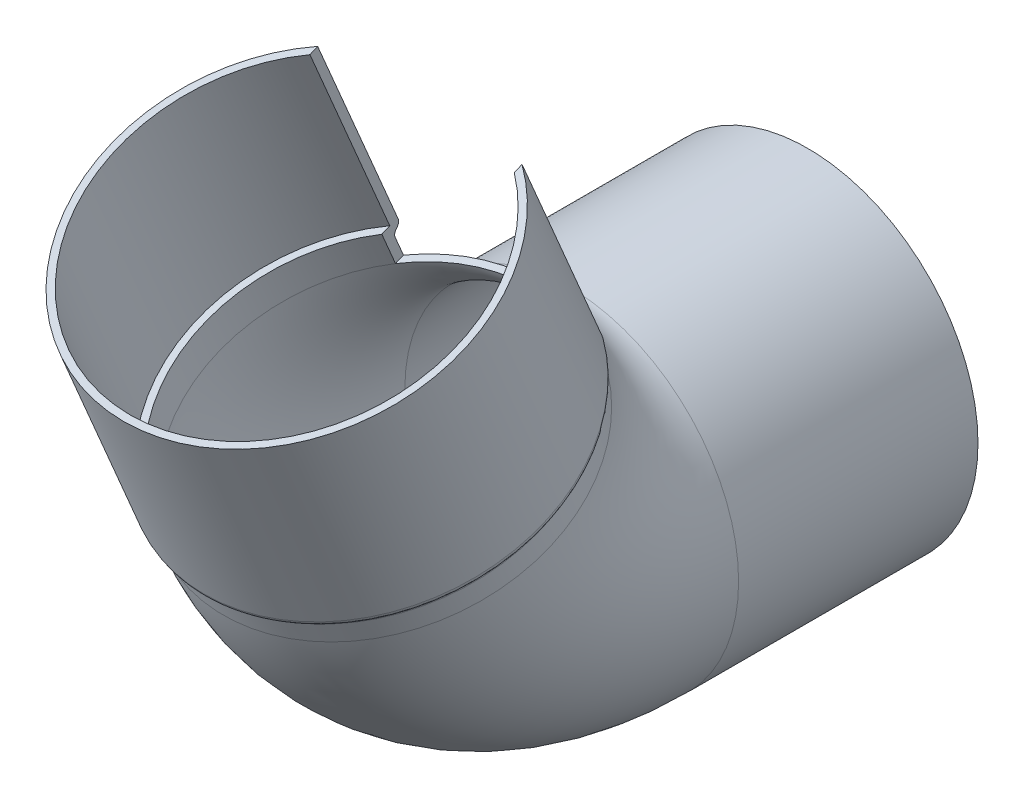
from build123d import *
from build123d.topology import SkipClean

# Parameters (mm, degrees)
ESQUISSE6_R             = 25
ESQUISSE6_R_2           = 24
ESQUISSE8_R             = 26
ESQUISSE8_R_2           = 24
EXTRU_MINCE1_DEPTH      = 1
EXTRU_MINCE2_START      = 30
ESQUISSE9_R             = 26
ESQUISSE9_R_2           = 25
EXTRU_MINCE2_DEPTH      = 30
CONG_1_R                = 1
CONG_2_R                = 1
ENL_V_MAT_EXTRU_1_DEPTH = 40


with BuildPart() as part:
    # Balayage-Mince2: sweep along a path in Esquisse7
    with BuildLine(Plane(origin=(0, 0, 0), x_dir=(0, 0, -1), z_dir=(1, 0, 0))) as balayage_mince2_path:
        Line((0, 0), (-35.14343316412919, -3.47e-15))
        ThreePointArc((-35.14343316412919, -3.47e-15), (-51.70154272349097, 4.983425337984965), (-62.75857876770245, 18.27806614532184))
        Line((-62.75857876770245, 18.27806614532184), (-64.37754708374251, 22.092116482858586))
    # Esquisse6 → Balayage-Mince2 (sweep)
    with BuildSketch(Plane.XY):
        Circle(ESQUISSE6_R)
        Circle(ESQUISSE6_R_2, mode=Mode.SUBTRACT)
    sweep(path=balayage_mince2_path.line)



with BuildPart() as body_2:
    # Esquisse8 → Extru.-Mince1 (new body)
    with BuildSketch(Plane(origin=(0, 41.87396099217143, 17.77444189612002), x_dir=(1, 0, 0), z_dir=(0, 0.9205048534524412, 0.39073112848927183))):
        with Locations((0, -50.62776693988426)):
            Circle(ESQUISSE8_R)
        with Locations((0, -50.62776693988426)):
            Circle(ESQUISSE8_R_2, mode=Mode.SUBTRACT)
    extrude(amount=EXTRU_MINCE1_DEPTH)


with BuildPart() as part_1:
    add(part.part)

    add(body_2.part)  # Extru.-Mince2 merges body 2
    # Esquisse9 → Extru.-Mince2 (add)
    with BuildSketch(Plane(origin=(0, 42.794465845623876, 18.16517302460929), x_dir=(1, 0, 0), z_dir=(0, 0.9205048534524412, 0.39073112848927183)).offset(EXTRU_MINCE2_START)):
        with Locations((0, -50.627766939884246)):
            Circle(ESQUISSE9_R)
        with Locations((0, -50.627766939884246)):
            Circle(ESQUISSE9_R_2, mode=Mode.SUBTRACT)
    extrude(amount=-EXTRU_MINCE2_DEPTH)

    # Congé1
    cong_1_edges = [part_1.edges().sort_by_distance(p)[0] for p in [
        (-25, 22.09211648285859, 64.3775470837425),
    ]]
    fillet(cong_1_edges, radius=CONG_1_R - 0.0001)  # a hair under: the kernel refuses the full size

    # Congé2
    cong_2_edges = [part_1.edges().sort_by_distance(p)[0] for p in [
        (-26, 22.092116482858604, 64.37754708374253),
    ]]
    fillet(cong_2_edges, radius=CONG_2_R)

    # Esquisse12 → Enlèv. mat.-Extru.1 (cut)
    with SkipClean():  # the faces are left unmerged after this step: merging them gives an invalid solid
        with BuildSketch(Plane(origin=(0, 0, 0), x_dir=(1, 0, 0), z_dir=(0, -0.39073112848927455, 0.9205048534524399))):
            Polygon((-15, 76.49021206691012), (15, 76.49021206691012), (15.000000000000004, 41.34677890278088), (-14.999999999999996, 41.34677890278088), align=None)
        extrude(amount=ENL_V_MAT_EXTRU_1_DEPTH, mode=Mode.SUBTRACT)


solid = part_1.part
